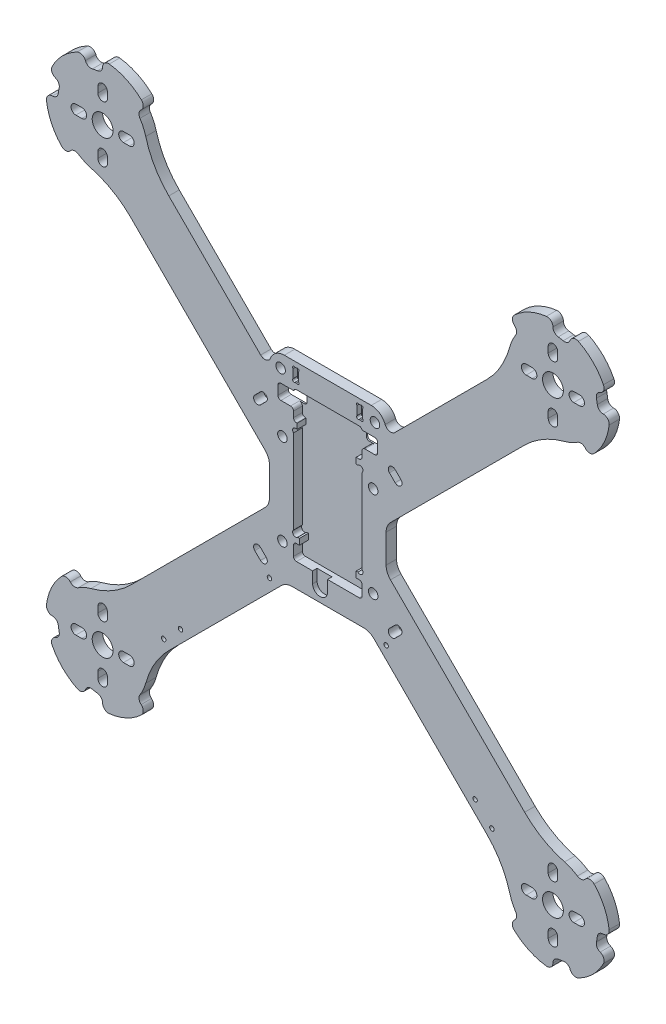
from build123d import *
from OCP.BRepFilletAPI import BRepFilletAPI_MakeFillet

# Parameters (mm, degrees)
ARM_SKELETON_DEPTH                  = 3.5
MOTOR_CENTER_HOLE_REACH             = 130.261
SKETCH4_R                           = 3.5
MOTOR_HOLES_REACH                   = 130.261
ELECTRONICS_HOLES_REACH             = 130.261
SKETCH7_R                           = 1.6
MOTOR_FILLET_R                      = 30
MOTOR_PROTECTOR_ARM_END_DEPTH       = 3.5
MOTOR_PROTECTOR_FILLET_R            = 2
MOTOR_FILLET_OF_MIRROR1_R           = 30
MOTOR_PROTECTOR_FILLET_OF_MIRROR1_R = 2
MIRROR2_OUTLINE_R                   = 3.5
MIRROR2_OUTLINE_R_2                 = 1.6
MIRROR2_DEPTH                       = 3.5
SKETCH12_W                          = 39.2
SKETCH12_H                          = 66
SKETCH12_R                          = 1.6
CENTER_SUPPORT_DEPTH                = 3.5
SKETCH13_R                          = 1.6
FRONT_SUPPORT_HOLES_DEPTH           = 10
FILLET3_R                           = 5
PDB_WIRE_HOLE_REACH                 = 135.749
SKETCH8_W                           = 6.84
SKETCH8_H                           = 5
FILLET5_R                           = 1
FILLET5_OF_MIRROR3_R                = 1
SKETCH9_W                           = 23.05
SKETCH9_H                           = 50
VTX_POCKET_CUT_DEPTH                = 3
FILLET2_R                           = 1
FILLET6_R                           = 1
SKETCH19_W                          = 2
SKETCH19_H                          = 2
SKETCH19_W_2                        = 1.2
HOLDER_EARS_DEPTH                   = 3
HOLDER_EAR_FILLET_R                 = 1
SKETCH20_R                          = 1
ENDMILL_CUT_DEPTH                   = 3
FILLET4_R1                          = 5
FILLET4_R2                          = 2
SKETCH14_R                          = 0.5
SKETCH14_W                          = 1.9
SKETCH14_H                          = 4.4
CAMERA_HOLDER_POCKET_DEPTH          = 1.6
ANTENNA_HOLE_REACH                  = 135.749
SKETCH16_R                          = 0.75
SKETCH22_R                          = 2.5
ANTENNA_CABLE_POCKET_DEPTH          = 1.5


# Read off the part's stored shape, not the designer's step: Mirror2
# Some blends are built 0.0001 mm under size
with BuildPart() as part:
    # Sketch1 → Arm skeleton (new body)
    with BuildSketch(Plane.XY):
        with BuildLine():
            Line((0, 12.727922061), (-60.811183182, 73.539105243))
            ThreePointArc((-60.811183182, 73.539105243), (-86.267027305, 86.267027305), (-73.539105243, 60.811183182))
            Line((-73.539105243, 60.811183182), (-12.727922061, 0))
            Line((-12.727922061, 0), (0, 0))
            Line((0, 0), (0, 12.727922061))
        make_face()
        with BuildLine():
            ThreePointArc((-22.627416998, 20.718228689), (-24.536605307, 20.718228689), (-24.536605307, 22.627416998))
            Line((-24.536605307, 22.627416998), (-22.627416998, 24.536605307))
            ThreePointArc((-22.627416998, 24.536605307), (-20.718228689, 24.536605307), (-20.718228689, 22.627416998))
            Line((-20.718228689, 22.627416998), (-22.627416998, 20.718228689))
        make_face(mode=Mode.SUBTRACT)
    arm_skeleton = extrude(amount=ARM_SKELETON_DEPTH)

    # Sketch4 → Motor center hole (cut, up to next)
    with BuildSketch(Plane.XY.offset(3.5), mode=Mode.PRIVATE) as motor_center_hole_sk1:
        with Locations((-75.660425587, 75.660425587)):
            Circle(SKETCH4_R)
    motor_center_hole_tool1 = extrude(motor_center_hole_sk1.sketch, amount=-MOTOR_CENTER_HOLE_REACH, mode=Mode.PRIVATE) & part.part
    motor_center_hole = motor_center_hole_tool1.solids().sort_by_distance((-75.660426, 75.660426, 3.5))[0]
    add(motor_center_hole, mode=Mode.SUBTRACT)

    # Sketch5 → Motor holes (cut, up to next)
    with BuildSketch(Plane.XY.offset(3.5), mode=Mode.PRIVATE) as motor_holes_sk1:
        with BuildLine():
            Line((-74.060425587, 86.160425587), (-74.060425587, 84.160425587))
            ThreePointArc((-74.060425587, 84.160425587), (-75.660425587, 82.560425587), (-77.260425587, 84.160425587))
            Line((-77.260425587, 84.160425587), (-77.260425587, 86.160425587))
            ThreePointArc((-77.260425587, 86.160425587), (-75.660425587, 87.760425587), (-74.060425587, 86.160425587))
        make_face()
    motor_holes_tool1 = extrude(motor_holes_sk1.sketch, amount=-MOTOR_HOLES_REACH, mode=Mode.PRIVATE) & part.part
    # Sketch5 → Motor holes (cut, up to next)
    with BuildSketch(Plane.XY.offset(3.5), mode=Mode.PRIVATE) as motor_holes_sk2:
        with BuildLine():
            Line((-68.660425587, 77.260425587), (-66.660425587, 77.260425587))
            ThreePointArc((-66.660425587, 77.260425587), (-65.060425587, 75.660425587), (-66.660425587, 74.060425587))
            Line((-66.660425587, 74.060425587), (-68.660425587, 74.060425587))
            ThreePointArc((-68.660425587, 74.060425587), (-70.260425587, 75.660425587), (-68.660425587, 77.260425587))
        make_face()
    motor_holes_tool2 = extrude(motor_holes_sk2.sketch, amount=-MOTOR_HOLES_REACH, mode=Mode.PRIVATE) & part.part
    # Sketch5 → Motor holes (cut, up to next)
    with BuildSketch(Plane.XY.offset(3.5), mode=Mode.PRIVATE) as motor_holes_sk3:
        with BuildLine():
            Line((-84.660425587, 77.260425587), (-82.660425587, 77.260425587))
            ThreePointArc((-82.660425587, 77.260425587), (-81.060425587, 75.660425587), (-82.660425587, 74.060425587))
            Line((-82.660425587, 74.060425587), (-84.660425587, 74.060425587))
            ThreePointArc((-84.660425587, 74.060425587), (-86.260425587, 75.660425587), (-84.660425587, 77.260425587))
        make_face()
    motor_holes_tool3 = extrude(motor_holes_sk3.sketch, amount=-MOTOR_HOLES_REACH, mode=Mode.PRIVATE) & part.part
    # Sketch5 → Motor holes (cut, up to next)
    with BuildSketch(Plane.XY.offset(3.5), mode=Mode.PRIVATE) as motor_holes_sk4:
        with BuildLine():
            Line((-77.260425587, 65.160425587), (-77.260425587, 67.160425587))
            ThreePointArc((-77.260425587, 67.160425587), (-75.660425587, 68.760425587), (-74.060425587, 67.160425587))
            Line((-74.060425587, 67.160425587), (-74.060425587, 65.160425587))
            ThreePointArc((-74.060425587, 65.160425587), (-75.660425587, 63.560425587), (-77.260425587, 65.160425587))
        make_face()
    motor_holes_tool4 = extrude(motor_holes_sk4.sketch, amount=-MOTOR_HOLES_REACH, mode=Mode.PRIVATE) & part.part
    motor_holes_1 = motor_holes_tool1.solids().sort_by_distance((-75.660426, 85.160426, 3.5))[0]
    add(motor_holes_1, mode=Mode.SUBTRACT)
    motor_holes_2 = motor_holes_tool2.solids().sort_by_distance((-67.660426, 75.660426, 3.5))[0]
    add(motor_holes_2, mode=Mode.SUBTRACT)
    motor_holes_3 = motor_holes_tool3.solids().sort_by_distance((-83.660426, 75.660426, 3.5))[0]
    add(motor_holes_3, mode=Mode.SUBTRACT)
    motor_holes_4 = motor_holes_tool4.solids().sort_by_distance((-75.660426, 66.160426, 3.5))[0]
    add(motor_holes_4, mode=Mode.SUBTRACT)
    motor_holes = motor_holes_1 + motor_holes_2 + motor_holes_3 + motor_holes_4  # Motor holes as one shape, for the pattern or mirror that repeats it

    # Sketch7 → Electronics holes (cut, up to next)
    with BuildSketch(Plane.XY.offset(3.5), mode=Mode.PRIVATE) as electronics_holes_sk1:
        with Locations((-15.25, 15.25)):
            Circle(SKETCH7_R)
    electronics_holes_tool1 = extrude(electronics_holes_sk1.sketch, amount=-ELECTRONICS_HOLES_REACH, mode=Mode.PRIVATE) & part.part
    electronics_holes = electronics_holes_tool1.solids().sort_by_distance((-15.25, 15.25, 3.5))[0]
    add(electronics_holes, mode=Mode.SUBTRACT)

    # Motor fillet
    motor_fillet_edges = [part.edges().sort_by_distance(p)[0] for p in [
        (-73.539105243, 60.811183182, 1.75),
        (-60.811183182, 73.539105243, 1.75),
    ]]
    fillet(motor_fillet_edges, radius=MOTOR_FILLET_R)

    # Sketch18 → Motor protector arm end (add)
    with BuildSketch(Plane.XY):
        with BuildLine():
            ThreePointArc((-61.105581168, 87.873390171), (-67.630678614, 92.880273541), (-75.660425587, 94.660425587))
            Line((-75.660425587, 94.660425587), (-75.660425587, 90.660425587))
            ThreePointArc((-75.660425587, 90.660425587), (-69.321151661, 89.255042393), (-64.16975894, 85.302239732))
            Line((-64.16975894, 85.302239732), (-61.105581168, 87.873390171))
        make_face()
        with BuildLine():
            Line((-80.790727737, 89.755814899), (-82.15880831, 93.514585382))
            ThreePointArc((-82.15880831, 93.514585382), (-89.09545443, 89.09545443), (-93.514585382, 82.15880831))
            Line((-93.514585382, 82.15880831), (-89.755814899, 80.790727737))
            ThreePointArc((-89.755814899, 80.790727737), (-86.267027305, 86.267027305), (-80.790727737, 89.755814899))
        make_face()
        with BuildLine():
            ThreePointArc((-94.660425587, 75.660425587), (-92.880273541, 67.630678614), (-87.873390171, 61.105581168))
            Line((-87.873390171, 61.105581168), (-85.302239732, 64.16975894))
            ThreePointArc((-85.302239732, 64.16975894), (-89.255042393, 69.321151661), (-90.660425587, 75.660425587))
            Line((-90.660425587, 75.660425587), (-94.660425587, 75.660425587))
        make_face()
    motor_protector_arm_end = extrude(amount=MOTOR_PROTECTOR_ARM_END_DEPTH)

    # Motor protector fillet
    motor_protector_fillet_edges = [part.edges().sort_by_distance(p)[0] for p in [
        (-94.660425587, 75.660425587, 1.75),
        (-85.302239732, 64.16975894, 1.75),
        (-87.873390171, 61.105581168, 1.75),
        (-90.660425587, 75.660425587, 1.75),
        (-89.755814899, 80.790727737, 1.75),
        (-93.514585382, 82.15880831, 1.75),
        (-82.15880831, 93.514585382, 1.75),
        (-80.790727737, 89.755814899, 1.75),
        (-75.660425587, 90.660425587, 1.75),
        (-75.660425587, 94.660425587, 1.75),
        (-61.105581168, 87.873390171, 1.75),
        (-64.16975894, 85.302239732, 1.75),
    ]]
    fillet(motor_protector_fillet_edges, radius=MOTOR_PROTECTOR_FILLET_R - 0.0001)  # a hair under: the kernel refuses the full size

    # Mirror1: Arm skeleton, Motor center hole, Motor holes, Electronics holes, Motor protector arm end across plane
    add(arm_skeleton.mirror(Plane(origin=(0, 0, 0), x_dir=(0, 0, 1), z_dir=(1, 0, 0))))
    add(motor_center_hole.mirror(Plane(origin=(0, 0, 0), x_dir=(0, 0, 1), z_dir=(1, 0, 0))), mode=Mode.SUBTRACT)
    add(motor_holes.mirror(Plane(origin=(0, 0, 0), x_dir=(0, 0, 1), z_dir=(1, 0, 0))), mode=Mode.SUBTRACT)
    add(electronics_holes.mirror(Plane(origin=(0, 0, 0), x_dir=(0, 0, 1), z_dir=(1, 0, 0))), mode=Mode.SUBTRACT)
    add(motor_protector_arm_end.mirror(Plane(origin=(0, 0, 0), x_dir=(0, 0, 1), z_dir=(1, 0, 0))))

    # Motor fillet of Mirror1
    motor_fillet_of_mirror1_edges = [part.edges().sort_by_distance(p)[0] for p in [
        (73.539105243, 60.811183182, 1.75),
        (60.811183182, 73.539105243, 1.75),
    ]]
    fillet(motor_fillet_of_mirror1_edges, radius=MOTOR_FILLET_OF_MIRROR1_R)

    # Motor protector fillet of Mirror1
    motor_protector_fillet_of_mirror1_edges = [part.edges().sort_by_distance(p)[0] for p in [
        (94.660425587, 75.660425587, 1.75),
        (85.302239732, 64.16975894, 1.75),
        (87.873390171, 61.105581168, 1.75),
        (90.660425587, 75.660425587, 1.75),
        (89.755814899, 80.790727737, 1.75),
        (93.514585382, 82.15880831, 1.75),
        (82.15880831, 93.514585382, 1.75),
        (80.790727737, 89.755814899, 1.75),
        (75.660425587, 90.660425587, 1.75),
        (75.660425587, 94.660425587, 1.75),
        (61.105581168, 87.873390171, 1.75),
        (64.16975894, 85.302239732, 1.75),
    ]]
    fillet(motor_protector_fillet_of_mirror1_edges, radius=MOTOR_PROTECTOR_FILLET_OF_MIRROR1_R - 0.0001)  # a hair under: the kernel refuses the full size

    # Mirror2 outline → Mirror2 (add)
    with BuildSketch(Plane.XY):
        with BuildLine():
            ThreePointArc((79.56131112, -61.176534809), (72.34640623, -58.179880361), (66.149878751, -53.42195669))
            Line((66.149878751, -53.42195669), (12.727922061, 0))
            Line((12.727922061, 0), (-12.727922061, 0))
            Line((-12.727922061, 0), (-66.149878751, -53.42195669))
            ThreePointArc((-66.149878751, -53.42195669), (-72.34640623, -58.179880361), (-79.56131112, -61.176534809))
            ThreePointArc((-79.56131112, -61.176534809), (-81.799388032, -61.974186509), (-83.883438745, -63.115225126))
            ThreePointArc((-83.883438745, -63.115225126), (-85.271252475, -63.421187603), (-86.511929385, -62.72810695))
            ThreePointArc((-86.511929385, -62.72810695), (-87.987413058, -62.014483368), (-89.500911528, -62.643477062))
            ThreePointArc((-89.500911528, -62.643477062), (-92.880273541, -67.630678614), (-94.528479546, -73.425131469))
            ThreePointArc((-94.528479546, -73.425131469), (-94.037458606, -74.988847915), (-92.542368603, -75.660425587))
            ThreePointArc((-92.542368603, -75.660425587), (-91.213946275, -76.165335584), (-90.55625766, -77.425131469))
            ThreePointArc((-90.55625766, -77.425131469), (-90.432541882, -78.265148252), (-90.261494025, -79.096819112))
            ThreePointArc((-90.261494025, -79.096819112), (-90.448643594, -80.505582764), (-91.524262864, -81.434390157))
            ThreePointArc((-91.524262864, -81.434390157), (-92.699494816, -82.576817637), (-92.626081047, -84.214169494))
            ThreePointArc((-92.626081047, -84.214169494), (-89.09545443, -89.09545443), (-84.214169494, -92.626081047))
            ThreePointArc((-84.214169494, -92.626081047), (-82.576817637, -92.699494816), (-81.434390157, -91.524262864))
            ThreePointArc((-81.434390157, -91.524262864), (-80.505582764, -90.448643594), (-79.096819112, -90.261494025))
            ThreePointArc((-79.096819112, -90.261494025), (-78.265148252, -90.432541882), (-77.425131469, -90.55625766))
            ThreePointArc((-77.425131469, -90.55625766), (-76.165335584, -91.213946275), (-75.660425587, -92.542368603))
            ThreePointArc((-75.660425587, -92.542368603), (-74.988847915, -94.037458606), (-73.425131469, -94.528479546))
            ThreePointArc((-73.425131469, -94.528479546), (-67.630678614, -92.880273541), (-62.643477062, -89.500911528))
            ThreePointArc((-62.643477062, -89.500911528), (-62.014483368, -87.987413058), (-62.72810695, -86.511929385))
            ThreePointArc((-62.72810695, -86.511929385), (-63.421187603, -85.271252475), (-63.115225126, -83.883438745))
            ThreePointArc((-63.115225126, -83.883438745), (-61.974186509, -81.799388032), (-61.176534809, -79.56131112))
            ThreePointArc((-61.176534809, -79.56131112), (-58.179880361, -72.34640623), (-53.42195669, -66.149878751))
            Line((-53.42195669, -66.149878751), (0, -12.727922061))
            Line((0, -12.727922061), (53.42195669, -66.149878751))
            ThreePointArc((53.42195669, -66.149878751), (58.179880361, -72.34640623), (61.176534809, -79.56131112))
            ThreePointArc((61.176534809, -79.56131112), (61.974186509, -81.799388032), (63.115225126, -83.883438745))
            ThreePointArc((63.115225126, -83.883438745), (63.421187603, -85.271252475), (62.72810695, -86.511929385))
            ThreePointArc((62.72810695, -86.511929385), (62.014483368, -87.987413058), (62.643477062, -89.500911528))
            ThreePointArc((62.643477062, -89.500911528), (67.630678614, -92.880273541), (73.425131469, -94.528479546))
            ThreePointArc((73.425131469, -94.528479546), (74.988847915, -94.037458606), (75.660425587, -92.542368603))
            ThreePointArc((75.660425587, -92.542368603), (76.165335584, -91.213946275), (77.425131469, -90.55625766))
            ThreePointArc((77.425131469, -90.55625766), (78.265148252, -90.432541882), (79.096819112, -90.261494025))
            ThreePointArc((79.096819112, -90.261494025), (80.505582764, -90.448643594), (81.434390157, -91.524262864))
            ThreePointArc((81.434390157, -91.524262864), (82.576817637, -92.699494816), (84.214169494, -92.626081047))
            ThreePointArc((84.214169494, -92.626081047), (89.09545443, -89.09545443), (92.626081047, -84.214169494))
            ThreePointArc((92.626081047, -84.214169494), (92.699494816, -82.576817637), (91.524262864, -81.434390157))
            ThreePointArc((91.524262864, -81.434390157), (90.448643594, -80.505582764), (90.261494025, -79.096819112))
            ThreePointArc((90.261494025, -79.096819112), (90.432541882, -78.265148252), (90.55625766, -77.425131469))
            ThreePointArc((90.55625766, -77.425131469), (91.213946275, -76.165335584), (92.542368603, -75.660425587))
            ThreePointArc((92.542368603, -75.660425587), (94.037458606, -74.988847915), (94.528479546, -73.425131469))
            ThreePointArc((94.528479546, -73.425131469), (92.880273541, -67.630678614), (89.500911528, -62.643477062))
            ThreePointArc((89.500911528, -62.643477062), (87.987413058, -62.014483368), (86.511929385, -62.72810695))
            ThreePointArc((86.511929385, -62.72810695), (85.271252475, -63.421187603), (83.883438745, -63.115225126))
            ThreePointArc((83.883438745, -63.115225126), (81.799388032, -61.974186509), (79.56131112, -61.176534809))
        make_face()
        with BuildLine():
            Line((-74.060425587, -84.160425587), (-74.060425587, -86.160425587))
            ThreePointArc((-74.060425587, -86.160425587), (-75.660425587, -87.760425587), (-77.260425587, -86.160425587))
            Line((-77.260425587, -86.160425587), (-77.260425587, -84.160425587))
            ThreePointArc((-77.260425587, -84.160425587), (-75.660425587, -82.560425587), (-74.060425587, -84.160425587))
        make_face(mode=Mode.SUBTRACT)
        with BuildLine():
            ThreePointArc((-84.660425587, -77.260425587), (-86.260425587, -75.660425587), (-84.660425587, -74.060425587))
            Line((-84.660425587, -74.060425587), (-82.660425587, -74.060425587))
            ThreePointArc((-82.660425587, -74.060425587), (-81.060425587, -75.660425587), (-82.660425587, -77.260425587))
            Line((-82.660425587, -77.260425587), (-84.660425587, -77.260425587))
        make_face(mode=Mode.SUBTRACT)
        with Locations((-75.660425587, -75.660425587)):
            Circle(MIRROR2_OUTLINE_R, mode=Mode.SUBTRACT)
        with BuildLine():
            Line((-66.660425587, -77.260425587), (-68.660425587, -77.260425587))
            ThreePointArc((-68.660425587, -77.260425587), (-70.260425587, -75.660425587), (-68.660425587, -74.060425587))
            Line((-68.660425587, -74.060425587), (-66.660425587, -74.060425587))
            ThreePointArc((-66.660425587, -74.060425587), (-65.060425587, -75.660425587), (-66.660425587, -77.260425587))
        make_face(mode=Mode.SUBTRACT)
        with BuildLine():
            Line((-74.060425587, -65.160425587), (-74.060425587, -67.160425587))
            ThreePointArc((-74.060425587, -67.160425587), (-75.660425587, -68.760425587), (-77.260425587, -67.160425587))
            Line((-77.260425587, -67.160425587), (-77.260425587, -65.160425587))
            ThreePointArc((-77.260425587, -65.160425587), (-75.660425587, -63.560425587), (-74.060425587, -65.160425587))
        make_face(mode=Mode.SUBTRACT)
        with BuildLine():
            ThreePointArc((74.060425587, -84.160425587), (75.660425587, -82.560425587), (77.260425587, -84.160425587))
            Line((77.260425587, -84.160425587), (77.260425587, -86.160425587))
            ThreePointArc((77.260425587, -86.160425587), (75.660425587, -87.760425587), (74.060425587, -86.160425587))
            Line((74.060425587, -86.160425587), (74.060425587, -84.160425587))
        make_face(mode=Mode.SUBTRACT)
        with BuildLine():
            ThreePointArc((68.660425587, -74.060425587), (70.260425587, -75.660425587), (68.660425587, -77.260425587))
            Line((68.660425587, -77.260425587), (66.660425587, -77.260425587))
            ThreePointArc((66.660425587, -77.260425587), (65.060425587, -75.660425587), (66.660425587, -74.060425587))
            Line((66.660425587, -74.060425587), (68.660425587, -74.060425587))
        make_face(mode=Mode.SUBTRACT)
        with Locations((75.660425587, -75.660425587)):
            Circle(MIRROR2_OUTLINE_R, mode=Mode.SUBTRACT)
        with BuildLine():
            ThreePointArc((84.660425587, -74.060425587), (86.260425587, -75.660425587), (84.660425587, -77.260425587))
            Line((84.660425587, -77.260425587), (82.660425587, -77.260425587))
            ThreePointArc((82.660425587, -77.260425587), (81.060425587, -75.660425587), (82.660425587, -74.060425587))
            Line((82.660425587, -74.060425587), (84.660425587, -74.060425587))
        make_face(mode=Mode.SUBTRACT)
        with BuildLine():
            ThreePointArc((74.060425587, -65.160425587), (75.660425587, -63.560425587), (77.260425587, -65.160425587))
            Line((77.260425587, -65.160425587), (77.260425587, -67.160425587))
            ThreePointArc((77.260425587, -67.160425587), (75.660425587, -68.760425587), (74.060425587, -67.160425587))
            Line((74.060425587, -67.160425587), (74.060425587, -65.160425587))
        make_face(mode=Mode.SUBTRACT)
        with BuildLine():
            Line((-22.627416998, -20.718228689), (-20.718228689, -22.627416998))
            ThreePointArc((-20.718228689, -22.627416998), (-20.718228689, -24.536605307), (-22.627416998, -24.536605307))
            Line((-22.627416998, -24.536605307), (-24.536605307, -22.627416998))
            ThreePointArc((-24.536605307, -22.627416998), (-24.536605307, -20.718228689), (-22.627416998, -20.718228689))
        make_face(mode=Mode.SUBTRACT)
        with Locations((-15.25, -15.25)):
            Circle(MIRROR2_OUTLINE_R_2, mode=Mode.SUBTRACT)
        with BuildLine():
            Line((24.536605307, -22.627416998), (22.627416998, -24.536605307))
            ThreePointArc((22.627416998, -24.536605307), (20.718228689, -24.536605307), (20.718228689, -22.627416998))
            Line((20.718228689, -22.627416998), (22.627416998, -20.718228689))
            ThreePointArc((22.627416998, -20.718228689), (24.536605307, -20.718228689), (24.536605307, -22.627416998))
        make_face(mode=Mode.SUBTRACT)
        with Locations((15.25, -15.25)):
            Circle(MIRROR2_OUTLINE_R_2, mode=Mode.SUBTRACT)
    extrude(amount=MIRROR2_DEPTH)

    # Sketch12 → Center support (add)
    with BuildSketch(Plane.XY.offset(3.5)):
        with Locations((0, 6.2)):
            Rectangle(SKETCH12_W, SKETCH12_H)
        with Locations((15.25, -15.25)):
            Circle(SKETCH12_R, mode=Mode.SUBTRACT)
        with Locations((-15.25, -15.25)):
            Circle(SKETCH12_R, mode=Mode.SUBTRACT)
        with Locations((15.25, 15.25)):
            Circle(SKETCH12_R, mode=Mode.SUBTRACT)
        with Locations((-15.25, 15.25)):
            Circle(SKETCH12_R, mode=Mode.SUBTRACT)
    extrude(amount=-CENTER_SUPPORT_DEPTH)

    # Sketch13 → Front support holes (cut)
    with BuildSketch(Plane.XY.offset(3.5)):
        with Locations((-15.85, 34.85)):
            Circle(SKETCH13_R)
        with Locations((15.85, 34.85)):
            Circle(SKETCH13_R)
    extrude(amount=-FRONT_SUPPORT_HOLES_DEPTH, mode=Mode.SUBTRACT)

    # Fillet3
    fillet3_edges = [part.edges().sort_by_distance(p)[0] for p in [
        (19.6, 39.2, 1.75),
        (-19.6, 39.2, 1.75),
    ]]
    fillet(fillet3_edges, radius=FILLET3_R)

    # Sketch8 → Pdb wire hole (cut, up to next)
    with BuildSketch(Plane(origin=(0, 0, 0), x_dir=(-1, 0, 0), z_dir=(0, 0, -1)), mode=Mode.PRIVATE) as pdb_wire_hole_sk1:
        with Locations((-13.343591006, 27.9623217)):
            Rectangle(SKETCH8_W, SKETCH8_H)
    pdb_wire_hole_tool1 = extrude(pdb_wire_hole_sk1.sketch, amount=-PDB_WIRE_HOLE_REACH, mode=Mode.PRIVATE) & part.part
    pdb_wire_hole = pdb_wire_hole_tool1.solids().sort_by_distance((13.343591, 27.962322, 0))[0]
    add(pdb_wire_hole, mode=Mode.SUBTRACT)

    # Fillet5
    fillet5_edges = [part.edges().sort_by_distance(p)[0] for p in [
        (9.923591006, 30.4623217, 1.75),
        (9.923591006, 25.4623217, 1.75),
        (16.763591006, 25.4623217, 1.75),
        (16.763591006, 30.4623217, 1.75),
    ]]
    fillet(fillet5_edges, radius=FILLET5_R)

    # Mirror3: Pdb wire hole across plane
    add(pdb_wire_hole.mirror(Plane(origin=(0, 0, 0), x_dir=(0, 0, 1), z_dir=(1, 0, 0))), mode=Mode.SUBTRACT)

    # Fillet5 of Mirror3
    fillet5_of_mirror3_edges = [part.edges().sort_by_distance(p)[0] for p in [
        (-9.923591006, 30.4623217, 1.75),
        (-9.923591006, 25.4623217, 1.75),
        (-16.763591006, 25.4623217, 1.75),
        (-16.763591006, 30.4623217, 1.75),
    ]]
    fillet(fillet5_of_mirror3_edges, radius=FILLET5_OF_MIRROR3_R)

    # Sketch9 → VTX pocket cut (cut)
    with BuildSketch(Plane.XY.offset(3.5)):
        with Locations((0, 6.2)):
            Rectangle(SKETCH9_W, SKETCH9_H)
    extrude(amount=-VTX_POCKET_CUT_DEPTH, mode=Mode.SUBTRACT)

    # Fillet2
    # the kernel refuses this fillet: 1 mm, written as the material it adds along each edge
    with BuildSketch(Plane(origin=(11.525, 31.2, 3.5), x_dir=(0, -1, 0), z_dir=(0, 0, -1))) as fillet2_piece_1:
        with BuildLine():
            CenterArc((1, 0.964980479), FILLET2_R, 180, 74.792131683)
            Line((0, 0.964980479), (-0.02, 0.964980479))
            Line((-0.02, 0.964980479), (-0.02, 0))
            Line((-0.02, 0), (0, -0.02))
            ThreePointArc((0, -0.02), (0.36883915, -0.02), (0.732431866, -0.01929961))
            Line((0.732431866, -0.01929961), (0.7376783, 0))
        make_face()
    extrude(amount=3)
    with BuildSketch(Plane(origin=(11.525, -18.8, 3.5), x_dir=(0, 1, 0), z_dir=(0, 0, -1))) as fillet2_piece_2:
        with BuildLine():
            CenterArc((FILLET2_R, -FILLET2_R), FILLET2_R, 90, 90)
            Line((0, -FILLET2_R), (-FILLET2_R * 0.02, -FILLET2_R))
            Line((-FILLET2_R * 0.02, -FILLET2_R), (-FILLET2_R * 0.02, FILLET2_R * 0.02))
            Line((-FILLET2_R * 0.02, FILLET2_R * 0.02), (FILLET2_R, FILLET2_R * 0.02))
            Line((FILLET2_R, FILLET2_R * 0.02), (FILLET2_R, 0))
        make_face()
    extrude(amount=3)
    with BuildSketch(Plane(origin=(-11.525, 31.2, 3.5), x_dir=(0, -1, 0), z_dir=(0, 0, -1))) as fillet2_piece_3:
        with BuildLine():
            CenterArc((1, -0.964980479), FILLET2_R, 105.207868317, 74.792131683)
            Line((0, -0.964980479), (-0.02, -0.964980479))
            Line((-0.02, -0.964980479), (-0.02, 0))
            Line((-0.02, 0), (0, 0.02))
            ThreePointArc((0, 0.02), (0.36883915, 0.02), (0.732431866, 0.01929961))
            Line((0.732431866, 0.01929961), (0.7376783, 0))
        make_face()
    extrude(amount=3)
    with BuildSketch(Plane(origin=(-11.525, -18.8, 3.5), x_dir=(0, 1, 0), z_dir=(0, 0, -1))) as fillet2_piece_4:
        with BuildLine():
            CenterArc((FILLET2_R, FILLET2_R), FILLET2_R, 180, 90)
            Line((0, FILLET2_R), (-FILLET2_R * 0.02, FILLET2_R))
            Line((-FILLET2_R * 0.02, FILLET2_R), (-FILLET2_R * 0.02, -FILLET2_R * 0.02))
            Line((-FILLET2_R * 0.02, -FILLET2_R * 0.02), (FILLET2_R, -FILLET2_R * 0.02))
            Line((FILLET2_R, -FILLET2_R * 0.02), (FILLET2_R, 0))
        make_face()
    extrude(amount=3)

    # Fillet6
    fillet6_edges = [part.edges().sort_by_distance(p)[0] for p in [
        (-11.525, 25.4623217, 2),
        (11.525, 25.4623217, 2),
    ]]
    fillet(fillet6_edges, radius=FILLET6_R)

    # Sketch19 → Holder ears (add)
    with BuildSketch(Plane.XY.offset(0.5)):
        with Locations((10.525, -12.56)):
            Rectangle(SKETCH19_W, SKETCH19_H)
        with Locations((-10.525, -12.56)):
            Rectangle(SKETCH19_W, SKETCH19_H)
        with Locations((10.525, 20.56)):
            Rectangle(SKETCH19_W, SKETCH19_H)
        with Locations((-10.925, 20.56)):
            Rectangle(SKETCH19_W_2, SKETCH19_H)
    extrude(amount=HOLDER_EARS_DEPTH)

    # Holder ear fillet
    holder_ear_fillet_edges = [part.edges().sort_by_distance(p)[0] for p in [
        (11.525, -13.56, 2),
        (11.525, 21.56, 2),
        (-11.525, -13.56, 2),
        (-11.525, 21.56, 2),
    ]]
    fillet(holder_ear_fillet_edges, radius=HOLDER_EAR_FILLET_R)

    # Sketch20 → Endmill cut (cut)
    with BuildSketch(Plane.XY.offset(3.5)):
        with Locations((10.817893219, -10.852893219)):
            Circle(SKETCH20_R)
        with Locations((-10.817893219, -10.852893219)):
            Circle(SKETCH20_R)
        with Locations((-10.817893219, 18.852893219)):
            Circle(SKETCH20_R)
        with Locations((10.817893219, 18.852893219)):
            Circle(SKETCH20_R)
    extrude(amount=-ENDMILL_CUT_DEPTH, mode=Mode.SUBTRACT)

    # Fillet4: one fillet with a radius per group of edges: ONE call of the kernel's fillet builder (fillet() takes one radius for all edges)
    fillet4_edges_1 = [part.edges().sort_by_distance(p)[0] for p in [
        (-19.6, 6.872077939, 1.75),
        (-19.6, -6.872077939, 1.75),
        (-14.072077939, -26.8, 1.75),
        (14.072077939, -26.8, 1.75),
        (19.6, -6.872077939, 1.75),
        (19.6, 6.872077939, 1.75),
    ]]
    fillet4_edges_2 = [part.edges().sort_by_distance(p)[0] for p in [
        (-19.6, 32.327922061, 1.75),
        (19.6, 32.327922061, 1.75),
    ]]
    fillet4 = BRepFilletAPI_MakeFillet(part.part.solid().wrapped)
    for e in fillet4_edges_1:
        fillet4.Add(FILLET4_R1, e.wrapped)
    for e in fillet4_edges_2:
        fillet4.Add(FILLET4_R2, e.wrapped)
    add(Compound.cast(fillet4.Shape()), mode=Mode.REPLACE)

    # Sketch14 → Camera holder pocket (cut)
    with BuildSketch(Plane.XY.offset(3.5)):
        with Locations((-11.346446609, 33.442913053)):
            Circle(SKETCH14_R)
        with Locations((-10.153553391, 33.442913053)):
            Circle(SKETCH14_R)
        with Locations((-10.153553391, 37.135806272)):
            Circle(SKETCH14_R)
        with Locations((-11.346446609, 37.135806272)):
            Circle(SKETCH14_R)
        with Locations((10.153553391, 33.442913053)):
            Circle(SKETCH14_R)
        with Locations((11.346446609, 33.442913053)):
            Circle(SKETCH14_R)
        with Locations((10.153553391, 37.135806272)):
            Circle(SKETCH14_R)
        with Locations((11.346446609, 37.135806272)):
            Circle(SKETCH14_R)
        with Locations((-10.75, 35.289359663)):
            Rectangle(SKETCH14_W, SKETCH14_H)
        with Locations((10.75, 35.289359663)):
            Rectangle(SKETCH14_W, SKETCH14_H)
    extrude(amount=-CAMERA_HOLDER_POCKET_DEPTH, mode=Mode.SUBTRACT)

    # Sketch16 → Antenna hole (cut, up to next)
    with BuildSketch(Plane(origin=(0, 0, 0), x_dir=(-1, 0, 0), z_dir=(0, 0, -1)), mode=Mode.PRIVATE) as antenna_hole_sk1:
        with Locations((-19.6, -28.1)):
            Circle(SKETCH16_R)
    antenna_hole_tool1 = extrude(antenna_hole_sk1.sketch, amount=-ANTENNA_HOLE_REACH, mode=Mode.PRIVATE) & part.part
    # Sketch16 → Antenna hole (cut, up to next)
    with BuildSketch(Plane(origin=(0, 0, 0), x_dir=(-1, 0, 0), z_dir=(0, 0, -1)), mode=Mode.PRIVATE) as antenna_hole_sk2:
        with Locations(Location((19.6, -28.1, 0), (0, 0, 180))):
            Circle(SKETCH16_R)
    antenna_hole_tool2 = extrude(antenna_hole_sk2.sketch, amount=-ANTENNA_HOLE_REACH, mode=Mode.PRIVATE) & part.part
    # Sketch16 → Antenna hole (cut, up to next)
    with BuildSketch(Plane(origin=(0, 0, 0), x_dir=(-1, 0, 0), z_dir=(0, 0, -1)), mode=Mode.PRIVATE) as antenna_hole_sk3:
        with Locations((-49.49011537, -57.99011537)):
            Circle(SKETCH16_R)
    antenna_hole_tool3 = extrude(antenna_hole_sk3.sketch, amount=-ANTENNA_HOLE_REACH, mode=Mode.PRIVATE) & part.part
    # Sketch16 → Antenna hole (cut, up to next)
    with BuildSketch(Plane(origin=(0, 0, 0), x_dir=(-1, 0, 0), z_dir=(0, 0, -1)), mode=Mode.PRIVATE) as antenna_hole_sk4:
        with Locations((-55.14696962, -63.64696962)):
            Circle(SKETCH16_R)
    antenna_hole_tool4 = extrude(antenna_hole_sk4.sketch, amount=-ANTENNA_HOLE_REACH, mode=Mode.PRIVATE) & part.part
    # Sketch16 → Antenna hole (cut, up to next)
    with BuildSketch(Plane(origin=(0, 0, 0), x_dir=(-1, 0, 0), z_dir=(0, 0, -1)), mode=Mode.PRIVATE) as antenna_hole_sk5:
        with Locations(Location((55.14696962, -63.64696962, 0), (0, 0, 180))):
            Circle(SKETCH16_R)
    antenna_hole_tool5 = extrude(antenna_hole_sk5.sketch, amount=-ANTENNA_HOLE_REACH, mode=Mode.PRIVATE) & part.part
    # Sketch16 → Antenna hole (cut, up to next)
    with BuildSketch(Plane(origin=(0, 0, 0), x_dir=(-1, 0, 0), z_dir=(0, 0, -1)), mode=Mode.PRIVATE) as antenna_hole_sk6:
        with Locations(Location((49.49011537, -57.99011537, 0), (0, 0, 180))):
            Circle(SKETCH16_R)
    antenna_hole_tool6 = extrude(antenna_hole_sk6.sketch, amount=-ANTENNA_HOLE_REACH, mode=Mode.PRIVATE) & part.part
    add(antenna_hole_tool1.solids().sort_by_distance((19.6, -28.1, 0))[0], mode=Mode.SUBTRACT)
    add(antenna_hole_tool2.solids().sort_by_distance((-19.6, -28.1, 0))[0], mode=Mode.SUBTRACT)
    add(antenna_hole_tool3.solids().sort_by_distance((49.490115, -57.990115, 0))[0], mode=Mode.SUBTRACT)
    add(antenna_hole_tool4.solids().sort_by_distance((55.14697, -63.64697, 0))[0], mode=Mode.SUBTRACT)
    add(antenna_hole_tool5.solids().sort_by_distance((-55.14697, -63.64697, 0))[0], mode=Mode.SUBTRACT)
    add(antenna_hole_tool6.solids().sort_by_distance((-49.490115, -57.990115, 0))[0], mode=Mode.SUBTRACT)

    # Sketch22 → Antenna cable pocket (cut)
    with BuildSketch(Plane.XY.offset(3.5)):
        with Locations((-2.6, -22.550148806)):
            Circle(SKETCH22_R)
        with BuildLine():
            Line((-0.1, -22.550148806), (-0.1, -18.050148806))
            Line((-0.1, -18.050148806), (-5.1, -18.050148806))
            Line((-5.1, -18.050148806), (-5.1, -22.550148806))
            ThreePointArc((-5.1, -22.550148806), (-2.6, -20.050148806), (-0.1, -22.550148806))
        make_face()
    extrude(amount=-ANTENNA_CABLE_POCKET_DEPTH, mode=Mode.SUBTRACT)


solid = part.part
